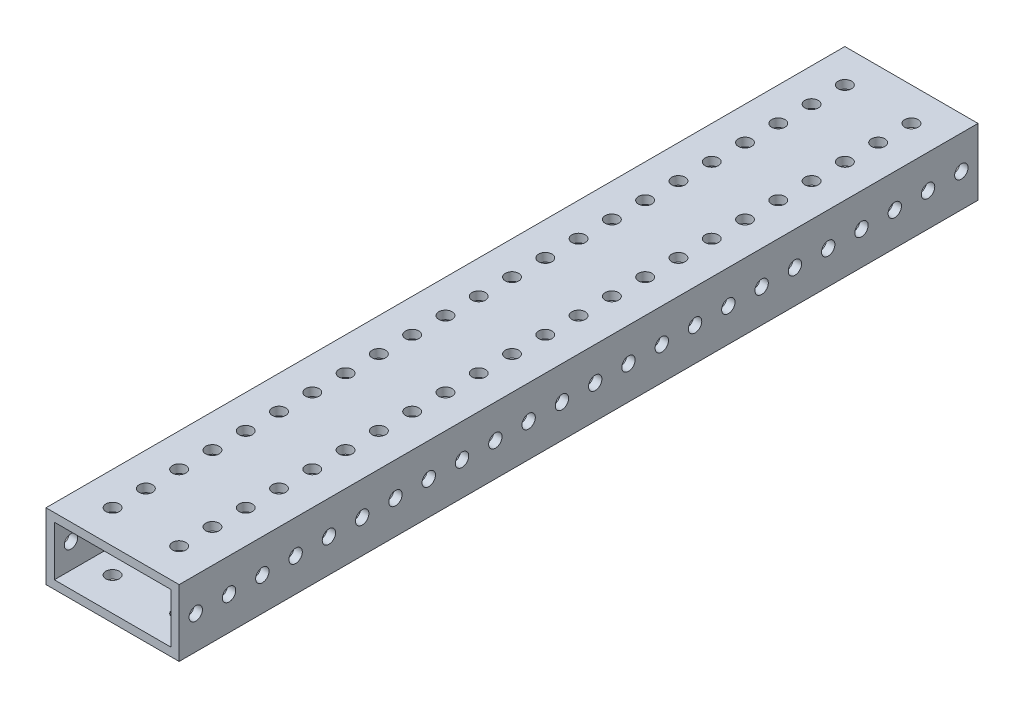
from build123d import *

# Parameters (mm, degrees)
SKETCH1_W           = 50.8
SKETCH1_H           = 25.4
SKETCH1_W_2         = 44.45
SKETCH1_H_2         = 19.05
BOSS_EXTRUDE1_DEPTH = 184.15
SKETCH6_R           = 2.5527
CUT_EXTRUDE5_DEPTH  = 192.450130582
SKETCH5_W           = 63.5
SKETCH5_H           = 25.4
CUT_EXTRUDE6_DEPTH  = 192.450130582
SKETCH2_R           = 2.5527
CUT_EXTRUDE1_DEPTH  = 188.620741124


with BuildPart() as part:
    # Sketch1 → Boss-Extrude1 (new, symmetric)
    with BuildSketch(Plane.XY):
        Rectangle(SKETCH1_W, SKETCH1_H)
        Rectangle(SKETCH1_W_2, SKETCH1_H_2, mode=Mode.SUBTRACT)
    extrude(amount=BOSS_EXTRUDE1_DEPTH, both=True)

    # Sketch6 → Cut-Extrude5 (cut, through all)
    with BuildSketch(Plane(origin=(25.4, 0, 0), x_dir=(0, 0, -1), z_dir=(1, 0, 0))):
        with Locations((-177.8, 0)):
            Circle(SKETCH6_R)
        with Locations((-165.1, 0)):
            Circle(SKETCH6_R)
        with Locations((-152.4, 0)):
            Circle(SKETCH6_R)
        with Locations((-139.7, 0)):
            Circle(SKETCH6_R)
        with Locations((-127, 0)):
            Circle(SKETCH6_R)
        with Locations((-114.3, 0)):
            Circle(SKETCH6_R)
        with Locations((-101.6, 0)):
            Circle(SKETCH6_R)
        with Locations((-88.9, 0)):
            Circle(SKETCH6_R)
        with Locations((-76.2, 0)):
            Circle(SKETCH6_R)
        with Locations((-63.5, 0)):
            Circle(SKETCH6_R)
        with Locations((-50.8, 0)):
            Circle(SKETCH6_R)
        with Locations((-38.1, 0)):
            Circle(SKETCH6_R)
        with Locations((-25.4, 0)):
            Circle(SKETCH6_R)
        with Locations((-12.7, 0)):
            Circle(SKETCH6_R)
        Circle(SKETCH6_R)
        with Locations((12.7, 0)):
            Circle(SKETCH6_R)
        with Locations((25.4, 0)):
            Circle(SKETCH6_R)
        with Locations((38.1, 0)):
            Circle(SKETCH6_R)
        with Locations((50.8, 0)):
            Circle(SKETCH6_R)
        with Locations((63.5, 0)):
            Circle(SKETCH6_R)
        with Locations((76.2, 0)):
            Circle(SKETCH6_R)
        with Locations((88.9, 0)):
            Circle(SKETCH6_R)
        with Locations((101.6, 0)):
            Circle(SKETCH6_R)
        with Locations((114.3, 0)):
            Circle(SKETCH6_R)
    extrude(amount=-CUT_EXTRUDE5_DEPTH, mode=Mode.SUBTRACT)

    # Sketch5 → Cut-Extrude6 (cut, through all)
    with BuildSketch(Plane.ZY.offset(25.4)):
        with Locations((-152.4, 0)):
            Rectangle(SKETCH5_W, SKETCH5_H)
    extrude(amount=-CUT_EXTRUDE6_DEPTH, mode=Mode.SUBTRACT)

    # Sketch2 → Cut-Extrude1 (cut, through all)
    with BuildSketch(Plane(origin=(0, 12.7, 0), x_dir=(1, 0, 0), z_dir=(0, 1, 0))):
        with Locations((12.7, -171.45)):
            Circle(SKETCH2_R)
        with Locations((-12.7, -171.45)):
            Circle(SKETCH2_R)
        with Locations((-12.7, -158.75)):
            Circle(SKETCH2_R)
        with Locations((-12.7, -146.05)):
            Circle(SKETCH2_R)
        with Locations((-12.7, -133.35)):
            Circle(SKETCH2_R)
        with Locations((-12.7, -120.65)):
            Circle(SKETCH2_R)
        with Locations((-12.7, -107.95)):
            Circle(SKETCH2_R)
        with Locations((-12.7, -95.25)):
            Circle(SKETCH2_R)
        with Locations((-12.7, -82.55)):
            Circle(SKETCH2_R)
        with Locations((-12.7, -69.85)):
            Circle(SKETCH2_R)
        with Locations((-12.7, -57.15)):
            Circle(SKETCH2_R)
        with Locations((-12.7, -44.45)):
            Circle(SKETCH2_R)
        with Locations((-12.7, -31.75)):
            Circle(SKETCH2_R)
        with Locations((-12.7, -19.05)):
            Circle(SKETCH2_R)
        with Locations((-12.7, -6.35)):
            Circle(SKETCH2_R)
        with Locations((-12.7, 6.35)):
            Circle(SKETCH2_R)
        with Locations((-12.7, 19.05)):
            Circle(SKETCH2_R)
        with Locations((-12.7, 31.75)):
            Circle(SKETCH2_R)
        with Locations((-12.7, 44.45)):
            Circle(SKETCH2_R)
        with Locations((-12.7, 57.15)):
            Circle(SKETCH2_R)
        with Locations((-12.7, 69.85)):
            Circle(SKETCH2_R)
        with Locations((-12.7, 82.55)):
            Circle(SKETCH2_R)
        with Locations((-12.7, 95.25)):
            Circle(SKETCH2_R)
        with Locations((-12.7, 107.95)):
            Circle(SKETCH2_R)
        with Locations((-12.7, 146.05)):
            Circle(SKETCH2_R)
        with Locations((-12.7, 158.75)):
            Circle(SKETCH2_R)
        with Locations((-12.7, 171.45)):
            Circle(SKETCH2_R)
        with Locations((-12.7, 196.85)):
            Circle(SKETCH2_R)
        with Locations((-12.7, 209.55)):
            Circle(SKETCH2_R)
        with Locations((-12.7, 222.25)):
            Circle(SKETCH2_R)
        with Locations((-12.7, 234.95)):
            Circle(SKETCH2_R)
        with Locations((-12.7, 247.65)):
            Circle(SKETCH2_R)
        with Locations((-12.7, 260.35)):
            Circle(SKETCH2_R)
        with Locations((-12.7, 273.05)):
            Circle(SKETCH2_R)
        with Locations((-12.7, 285.75)):
            Circle(SKETCH2_R)
        with Locations((-12.7, 298.45)):
            Circle(SKETCH2_R)
        with Locations((-12.7, 311.15)):
            Circle(SKETCH2_R)
        with Locations((-12.7, 323.85)):
            Circle(SKETCH2_R)
        with Locations((-12.7, 336.55)):
            Circle(SKETCH2_R)
        with Locations((-12.7, 349.25)):
            Circle(SKETCH2_R)
        with Locations((-12.7, 361.95)):
            Circle(SKETCH2_R)
        with Locations((-12.7, 374.65)):
            Circle(SKETCH2_R)
        with Locations((-12.7, 387.35)):
            Circle(SKETCH2_R)
        with Locations((-12.7, 400.05)):
            Circle(SKETCH2_R)
        with Locations((-12.7, 412.75)):
            Circle(SKETCH2_R)
        with Locations((12.7, -158.75)):
            Circle(SKETCH2_R)
        with Locations((12.7, -146.05)):
            Circle(SKETCH2_R)
        with Locations((12.7, -133.35)):
            Circle(SKETCH2_R)
        with Locations((12.7, -120.65)):
            Circle(SKETCH2_R)
        with Locations((12.7, -107.95)):
            Circle(SKETCH2_R)
        with Locations((12.7, -95.25)):
            Circle(SKETCH2_R)
        with Locations((12.7, -82.55)):
            Circle(SKETCH2_R)
        with Locations((12.7, -69.85)):
            Circle(SKETCH2_R)
        with Locations((12.7, -57.15)):
            Circle(SKETCH2_R)
        with Locations((12.7, -44.45)):
            Circle(SKETCH2_R)
        with Locations((12.7, -31.75)):
            Circle(SKETCH2_R)
        with Locations((12.7, -19.05)):
            Circle(SKETCH2_R)
        with Locations((12.7, -6.35)):
            Circle(SKETCH2_R)
        with Locations((12.7, 6.35)):
            Circle(SKETCH2_R)
        with Locations((12.7, 19.05)):
            Circle(SKETCH2_R)
        with Locations((12.7, 31.75)):
            Circle(SKETCH2_R)
        with Locations((12.7, 44.45)):
            Circle(SKETCH2_R)
        with Locations((12.7, 57.15)):
            Circle(SKETCH2_R)
        with Locations((12.7, 69.85)):
            Circle(SKETCH2_R)
        with Locations((12.7, 82.55)):
            Circle(SKETCH2_R)
        with Locations((12.7, 95.25)):
            Circle(SKETCH2_R)
        with Locations((12.7, 107.95)):
            Circle(SKETCH2_R)
        with Locations((12.7, 146.05)):
            Circle(SKETCH2_R)
        with Locations((12.7, 158.75)):
            Circle(SKETCH2_R)
        with Locations((12.7, 171.45)):
            Circle(SKETCH2_R)
        with Locations((12.7, 196.85)):
            Circle(SKETCH2_R)
        with Locations((12.7, 209.55)):
            Circle(SKETCH2_R)
        with Locations((12.7, 222.25)):
            Circle(SKETCH2_R)
        with Locations((12.7, 234.95)):
            Circle(SKETCH2_R)
        with Locations((12.7, 247.65)):
            Circle(SKETCH2_R)
        with Locations((12.7, 260.35)):
            Circle(SKETCH2_R)
        with Locations((12.7, 273.05)):
            Circle(SKETCH2_R)
        with Locations((12.7, 285.75)):
            Circle(SKETCH2_R)
        with Locations((12.7, 298.45)):
            Circle(SKETCH2_R)
        with Locations((12.7, 311.15)):
            Circle(SKETCH2_R)
        with Locations((12.7, 323.85)):
            Circle(SKETCH2_R)
        with Locations((12.7, 336.55)):
            Circle(SKETCH2_R)
        with Locations((12.7, 349.25)):
            Circle(SKETCH2_R)
        with Locations((12.7, 361.95)):
            Circle(SKETCH2_R)
        with Locations((12.7, 374.65)):
            Circle(SKETCH2_R)
        with Locations((12.7, 387.35)):
            Circle(SKETCH2_R)
        with Locations((12.7, 400.05)):
            Circle(SKETCH2_R)
        with Locations((12.7, 412.75)):
            Circle(SKETCH2_R)
        with Locations((12.7, 425.45)):
            Circle(SKETCH2_R)
        with Locations((12.7, 438.15)):
            Circle(SKETCH2_R)
        with Locations((12.7, 450.85)):
            Circle(SKETCH2_R)
    extrude(amount=-CUT_EXTRUDE1_DEPTH, mode=Mode.SUBTRACT)


solid = part.part
